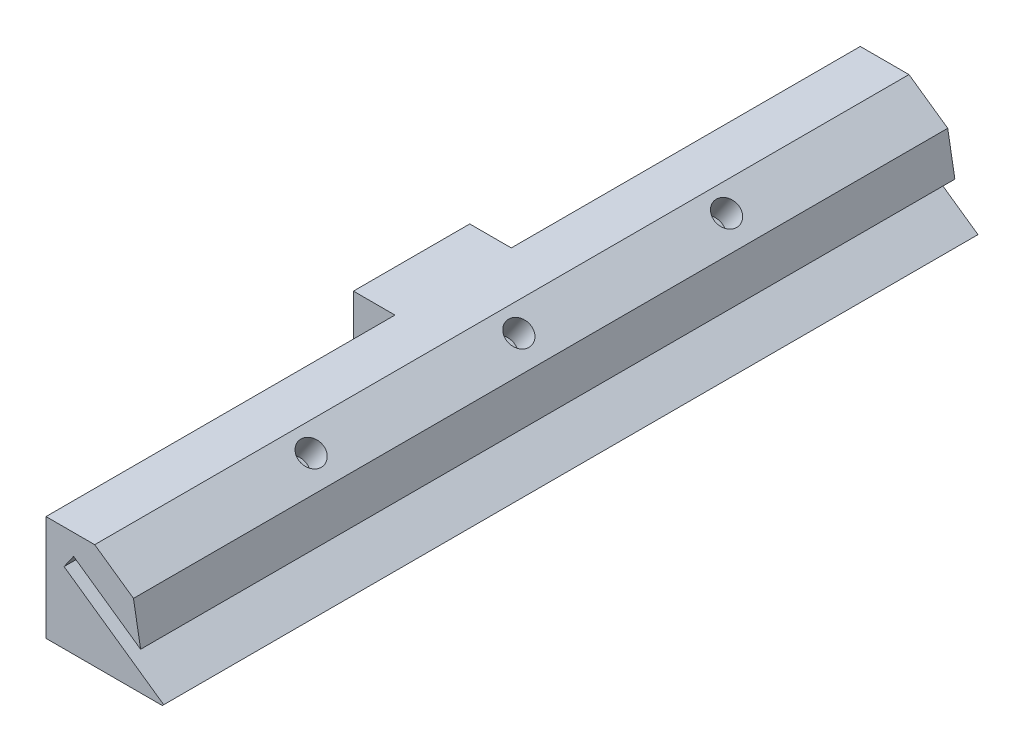
from build123d import *

# Parameters (mm, degrees)
RESSALTO_EXTRUS_O1_DEPTH                            = 98
ESBO_O4_W                                           = 33
ESBO_O4_H                                           = 22
CORTE_EXTRUS_O3_DEPTH                               = 25
ESBO_O10_W                                          = 12
ESBO_O10_H                                          = 4
CORTE_EXTRUS_O8_DEPTH                               = 122.545423608
ESBO_O11_R                                          = 1.6
CORTE_EXTRUS_O9_DEPTH                               = 20
ESBO_O12_W                                          = 22
ESBO_O12_H                                          = 40
CORTE_EXTRUS_O10_DEPTH                              = 10
FILETE1_R                                           = 2.5
ESCAREADO_PARA_PARAFUSO_ALLEN_SEXTAVADO_D           = 4.3
ESCAREADO_PARA_PARAFUSO_ALLEN_SEXTAVADO_CSINK_D     = 8.96
ESCAREADO_PARA_PARAFUSO_ALLEN_SEXTAVADO_CSINK_ANGLE = 90
ESBO_O15_W                                          = 4
ESBO_O15_H                                          = 22
CORTE_EXTRUS_O11_DEPTH                              = 137.386546257
ESBO_O16_W                                          = 59.5
ESBO_O16_H                                          = 54
ESBO_O16_R                                          = 2.15
CORTE_EXTRUS_O12_DEPTH                              = 137.386546257
CHANFRO1_SIZE                                       = 10
CHANFRO1_SIZE2                                      = 7.180150431
CORTE_EXTRUS_O14_DEPTH                              = 102.622518505
CORTE_EXTRUS_O14_DEPTH_BACK                         = 102.622518505
CHANFRO2_SIZE                                       = 8
CHANFRO2_SIZE_2                                     = 9.267647445
CORTE_EXTRUS_O15_REACH                              = 121.956
ESBO_O19_R                                          = 1.5


with BuildPart() as part:
    # Esboço1 → Ressalto-extrusão1 (new body)
    with BuildSketch(Plane.XY):
        Polygon((0, 0), (94, 0), (75.862520314, 12.7), (0, 12.7), align=None)
    extrude(amount=RESSALTO_EXTRUS_O1_DEPTH)

    # Esboço4 → Corte-extrusão3 (cut)
    with BuildSketch(Plane(origin=(0, 12.7, 0), x_dir=(1, 0, 0), z_dir=(0, 1, 0))):
        with Locations((16.5, -87)):
            Rectangle(ESBO_O4_W, ESBO_O4_H)
        with Locations((16.5, -11)):
            Rectangle(ESBO_O4_W, ESBO_O4_H)
        with Locations((53.5, -87)):
            Rectangle(ESBO_O4_W, ESBO_O4_H)
        with Locations((53.5, -11)):
            Rectangle(ESBO_O4_W, ESBO_O4_H)
    extrude(amount=-CORTE_EXTRUS_O3_DEPTH, mode=Mode.SUBTRACT)

    # Esboço10 → Corte-extrusão8 (cut, through all)
    with BuildSketch(Plane.XY.offset(76)):
        with Locations((16.5, 10.7)):
            Rectangle(ESBO_O10_W, ESBO_O10_H)
        with Locations((53.5, 10.7)):
            Rectangle(ESBO_O10_W, ESBO_O10_H)
    extrude(amount=-CORTE_EXTRUS_O8_DEPTH, mode=Mode.SUBTRACT)

    # Esboço11 → Corte-extrusão9 (cut)
    with BuildSketch(Plane(origin=(0, 12.7, 0), x_dir=(1, 0, 0), z_dir=(0, 1, 0))):
        with Locations(Location((29.25, -26.5, 0), (0, 0, 180))):
            Circle(ESBO_O11_R)
        with Locations(Location((29.25, -71.5, 0), (0, 0, 180))):
            Circle(ESBO_O11_R)
        with Locations(Location((3.75, -71.5, 0), (0, 0, 180))):
            Circle(ESBO_O11_R)
        with Locations(Location((3.75, -26.5, 0), (0, 0, 180))):
            Circle(ESBO_O11_R)
        with Locations(Location((40.75, -26.5, 0), (0, 0, 180))):
            Circle(ESBO_O11_R)
        with Locations(Location((66.25, -26.5, 0), (0, 0, 180))):
            Circle(ESBO_O11_R)
        with Locations(Location((66.25, -71.5, 0), (0, 0, 180))):
            Circle(ESBO_O11_R)
        with Locations(Location((40.75, -71.5, 0), (0, 0, 180))):
            Circle(ESBO_O11_R)
    extrude(amount=-CORTE_EXTRUS_O9_DEPTH, mode=Mode.SUBTRACT)

    # Esboço12 → Corte-extrusão10 (cut)
    with BuildSketch(Plane(origin=(0, 12.7, 0), x_dir=(1, 0, 0), z_dir=(0, 1, 0))):
        with Locations((35, -49)):
            Rectangle(ESBO_O12_W, ESBO_O12_H)
    extrude(amount=-CORTE_EXTRUS_O10_DEPTH, mode=Mode.SUBTRACT)

    # Filete1
    filete1_edges = [part.edges().sort_by_distance(p)[0] for p in [
        (46, 7.7, 29),
        (46, 7.7, 69),
        (24, 7.7, 69),
        (24, 7.7, 29),
    ]]
    fillet(filete1_edges, radius=FILETE1_R)

    # Escareado para parafuso Allen sextavado escareado de M41 (through all)
    with Locations(Plane(origin=(0, 0, 0), x_dir=(-1, 0, 0), z_dir=(0, -1, 0))):
        with Locations((-66.25, -71.5), (-66.25, -26.5), (-40.75, -26.5), (-29.25, -26.5), (-29.25, -71.5), (-40.75, -71.5), (-3.75, -71.5), (-3.75, -26.5)):
            CounterSinkHole(ESCAREADO_PARA_PARAFUSO_ALLEN_SEXTAVADO_D / 2, ESCAREADO_PARA_PARAFUSO_ALLEN_SEXTAVADO_CSINK_D / 2, counter_sink_angle=ESCAREADO_PARA_PARAFUSO_ALLEN_SEXTAVADO_CSINK_ANGLE)

    # Esboço15 → Corte-extrusão11 (cut, through all)
    with BuildSketch(Plane(origin=(0, 12.7, 0), x_dir=(1, 0, 0), z_dir=(0, 1, 0))):
        with Locations((35, -11)):
            Rectangle(ESBO_O15_W, ESBO_O15_H)
        with Locations((35, -87)):
            Rectangle(ESBO_O15_W, ESBO_O15_H)
    extrude(amount=-CORTE_EXTRUS_O11_DEPTH, mode=Mode.SUBTRACT)

    # Esboço16 → Corte-extrusão12 (cut, through all)
    # profile 1 of 2: a face of its own
    with BuildSketch(Plane(origin=(0, 12.7, 0), x_dir=(1, 0, 0), z_dir=(0, 1, 0))):
        with Locations((29.75, -49)):
            Rectangle(ESBO_O16_W, ESBO_O16_H)
    # profile 2 of 2: a face of its own
    with BuildSketch(Plane(origin=(0, 12.7, 0), x_dir=(1, 0, 0), z_dir=(0, 1, 0))):
        Polygon((70, -42), (70, -22), (59.5, -22), (59.5, -76), (70, -76), (70, -56), (65, -56), (65, -42), align=None)
        with Locations((66.25, -71.5)):
            Circle(ESBO_O16_R, mode=Mode.SUBTRACT)
        with Locations((66.25, -26.5)):
            Circle(ESBO_O16_R, mode=Mode.SUBTRACT)
    extrude(amount=-CORTE_EXTRUS_O12_DEPTH, mode=Mode.SUBTRACT)

    # Chanfro1
    chanfro1_edges = [part.edges().sort_by_distance(p)[0] for p in [
        (94, 0, 49),
    ]]
    chanfro1_side = [part.faces().sort_by_distance(p)[0] for p in [
        (81.603595513, 0, 49),
    ]]
    chamfer(chanfro1_edges, length=CHANFRO1_SIZE, length2=CHANFRO1_SIZE2, reference=chanfro1_side[0])

    # Esboço18 → Corte-extrusão14 (cut, two sides: drawn at the far end of the back side and taken through both)
    with BuildSketch(Plane.XY.offset(49).offset(-CORTE_EXTRUS_O14_DEPTH_BACK)):
        Polygon((73.318031781, 10.208958991), (85.605312446, 1.605312446), (84.16928236, 0.16928236), (72.170878909, 8.570654902), align=None)
    extrude(amount=CORTE_EXTRUS_O14_DEPTH + CORTE_EXTRUS_O14_DEPTH_BACK, mode=Mode.SUBTRACT)

    # Chanfro2
    # the kernel refuses this chamfer: 9.267647445, 8 mm, written as the material it takes off along each edge
    with BuildSketch(Plane(origin=(88.118365096, 4.118365096, -23.833451274), x_dir=(-0.6804962674600086, -0.7327515472334374, 0), z_dir=(0, 0, 1))) as chanfro2_piece_1_section:
        Polygon((CHANFRO2_SIZE * 0.999317113267, -CHANFRO2_SIZE * 0.0369500626806), (CHANFRO2_SIZE_2 * 0.137140887434, -CHANFRO2_SIZE_2 * 0.990551551958), (0, 0), align=None)
    chanfro2_piece_1 = extrude(amount=145.666902548, mode=Mode.PRIVATE)
    chanfro2_piece_1 = split(chanfro2_piece_1, bisect_by=Plane(origin=(81.702068422, 1.896844157, 49), z_dir=(0.5735764363510464, 0.8191520442889916, 0)), keep=Keep.TOP, mode=Mode.PRIVATE)
    add(chanfro2_piece_1, mode=Mode.SUBTRACT)

    # Esboço19 → Corte-extrusão15 (cut, up to next)
    with BuildSketch(Plane(origin=(30.925053264, 44.165553177, 0), x_dir=(0.819152044288991, -0.5735764363510472, 0), z_dir=(0.5735764363510472, 0.819152044288991, 0)), mode=Mode.PRIVATE) as corte_extrus_o15_sk1:
        with Locations(Location((57.358517859, -74, 0), (0, 0, 180))):
            Circle(ESBO_O19_R)
    corte_extrus_o15_tool1 = extrude(corte_extrus_o15_sk1.sketch, amount=-CORTE_EXTRUS_O15_REACH, mode=Mode.PRIVATE) & part.part
    # Esboço19 → Corte-extrusão15 (cut, up to next)
    with BuildSketch(Plane(origin=(30.925053264, 44.165553177, 0), x_dir=(0.819152044288991, -0.5735764363510472, 0), z_dir=(0.5735764363510472, 0.819152044288991, 0)), mode=Mode.PRIVATE) as corte_extrus_o15_sk2:
        with Locations(Location((57.358517859, -49, 0), (0, 0, 180))):
            Circle(ESBO_O19_R)
    corte_extrus_o15_tool2 = extrude(corte_extrus_o15_sk2.sketch, amount=-CORTE_EXTRUS_O15_REACH, mode=Mode.PRIVATE) & part.part
    # Esboço19 → Corte-extrusão15 (cut, up to next)
    with BuildSketch(Plane(origin=(30.925053264, 44.165553177, 0), x_dir=(0.819152044288991, -0.5735764363510472, 0), z_dir=(0.5735764363510472, 0.819152044288991, 0)), mode=Mode.PRIVATE) as corte_extrus_o15_sk3:
        with Locations(Location((57.358517859, -24, 0), (0, 0, 180))):
            Circle(ESBO_O19_R)
    corte_extrus_o15_tool3 = extrude(corte_extrus_o15_sk3.sketch, amount=-CORTE_EXTRUS_O15_REACH, mode=Mode.PRIVATE) & part.part
    add(corte_extrus_o15_tool1.solids().sort_by_distance((77.9104, 11.266059, 74))[0], mode=Mode.SUBTRACT)
    add(corte_extrus_o15_tool2.solids().sort_by_distance((77.9104, 11.266059, 49))[0], mode=Mode.SUBTRACT)
    add(corte_extrus_o15_tool3.solids().sort_by_distance((77.9104, 11.266059, 24))[0], mode=Mode.SUBTRACT)


solid = part.part
